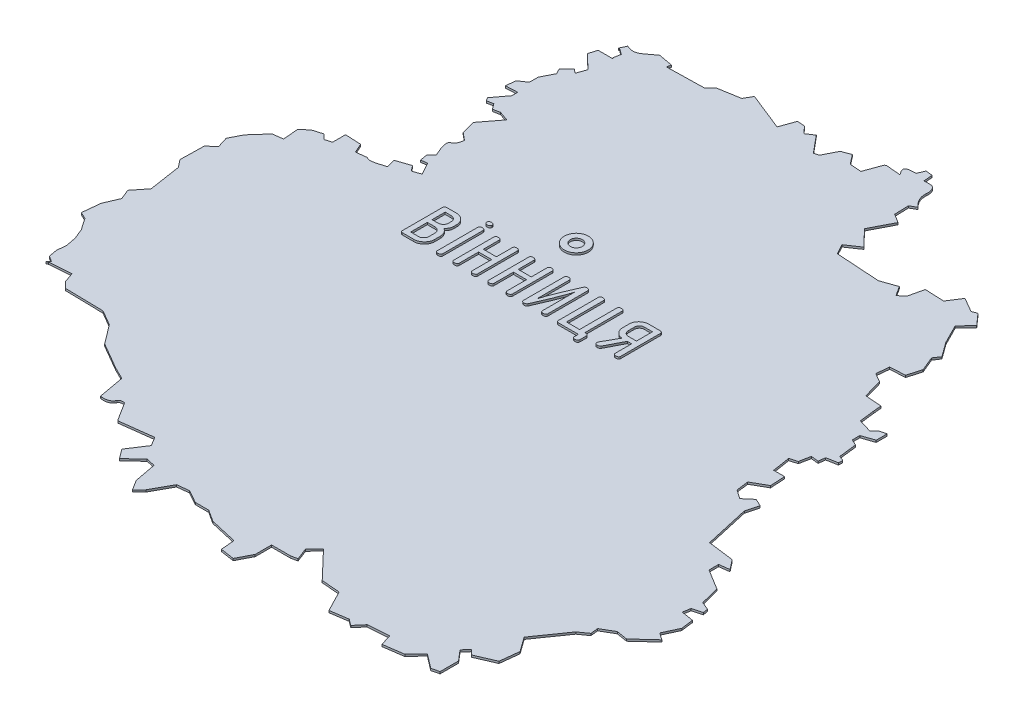
from build123d import *

# Parameters (mm, degrees)
EXTRUDE_1_DEPTH = 5
SKETCH_2_R      = 30
SKETCH_2_R_2    = 15
EXTRUDE_2_DEPTH = 10
SCALE_1_SCALE   = 0.05


with BuildPart() as part:
    # Эскиз1 → Бобышка-Вытянуть1 (new body)
    with BuildSketch(Plane(origin=(0, 0, 0), x_dir=(1, 0, 0), z_dir=(0, 1, 0))):
        with BuildLine():
            Line((-2037.80898, 5856.32306), (-2034.57302, 5821.92384))
            Line((-2034.57302, 5821.92384), (-2000.17888, 5816.7524))
            Line((-2000.17888, 5816.7524), (-1981.3651, 5853.08456))
            Line((-1981.3651, 5853.08456), (-1981.3651, 5893.97602))
            Line((-1981.3651, 5893.97602), (-1933.97886, 5893.97602))
            Line((-1933.97886, 5893.97602), (-1918.40358, 5897.21452))
            Line((-1918.40358, 5897.21452), (-1930.0952, 5927.69198))
            Line((-1930.0952, 5927.69198), (-1908.0353, 5950.4326))
            Line((-1908.0353, 5950.4326), (-1841.19266, 5880.33368))
            Line((-1841.19266, 5880.33368), (-1795.12722, 5876.45764))
            Line((-1795.12722, 5876.45764), (-1767.86794, 5823.88472))
            Line((-1767.86794, 5823.88472), (-1723.72528, 5830.39474))
            Line((-1723.72528, 5830.39474), (-1708.17794, 5818.6955))
            Line((-1708.17794, 5818.6955), (-1689.3413, 5840.77318))
            Line((-1689.3413, 5840.77318), (-1636.78616, 5844.63906))
            Line((-1636.78616, 5844.63906), (-1628.33304, 5816.7524))
            Line((-1628.33304, 5816.7524), (-1578.37886, 5823.88472))
            Line((-1578.37886, 5823.88472), (-1551.1145, 5853.08456))
            Line((-1551.1145, 5853.08456), (-1515.41226, 5825.81766))
            Line((-1515.41226, 5825.81766), (-1496.5934, 5830.39474))
            Line((-1496.5934, 5830.39474), (-1496.5934, 5876.45764))
            Line((-1496.5934, 5876.45764), (-1518.6787, 5902.41136))
            Line((-1518.6787, 5902.41136), (-1505.04144, 5917.9968))
            Line((-1505.04144, 5917.9968), (-1493.35998, 5905.6397))
            Line((-1493.35998, 5905.6397), (-1445.3362, 5926.44992))
            Line((-1445.3362, 5926.44992), (-1440.14444, 5973.78028))
            Line((-1440.14444, 5973.78028), (-1466.09816, 6010.13022))
            Line((-1466.09816, 6010.13022), (-1412.89532, 6086.03812))
            Line((-1412.89532, 6086.03812), (-1390.84558, 6101.62356))
            Line((-1390.84558, 6101.62356), (-1392.77598, 6120.46274))
            Line((-1392.77598, 6120.46274), (-1361.62796, 6138.61104))
            Line((-1361.62796, 6138.61104), (-1334.37884, 6134.06698))
            Line((-1334.37884, 6134.06698), (-1288.29562, 6176.24876))
            Line((-1288.29562, 6176.24876), (-1305.814, 6188.57284))
            Line((-1305.814, 6188.57284), (-1288.29562, 6226.19278))
            Line((-1288.29562, 6226.19278), (-1292.21484, 6256.73628))
            Line((-1292.21484, 6256.73628), (-1322.69484, 6261.90772))
            Line((-1322.69484, 6261.90772), (-1319.45634, 6280.73928))
            Line((-1319.45634, 6280.73928), (-1295.43556, 6287.22644))
            Line((-1295.43556, 6287.22644), (-1297.37358, 6299.5556))
            Line((-1297.37358, 6299.5556), (-1317.49038, 6307.97824))
            Line((-1317.49038, 6307.97824), (-1329.8297, 6355.35432))
            Line((-1329.8297, 6355.35432), (-1380.4392, 6386.50234))
            Line((-1380.4392, 6386.50234), (-1380.4392, 6410.51804))
            Line((-1380.4392, 6410.51804), (-1355.12302, 6413.77178))
            Line((-1355.12302, 6413.77178), (-1373.95712, 6437.77224))
            Line((-1373.95712, 6437.77224), (-1438.85158, 6446.21266))
            Line((-1438.85158, 6446.21266), (-1464.16014, 6558.46796))
            Line((-1464.16014, 6558.46796), (-1455.70956, 6589.6109))
            Line((-1455.70956, 6589.6109), (-1474.54874, 6598.07672))
            Line((-1474.54874, 6598.07672), (-1496.5934, 6579.24516))
            Line((-1496.5934, 6579.24516), (-1518.6787, 6594.81282))
            Line((-1518.6787, 6594.81282), (-1522.55474, 6625.31314))
            Line((-1522.55474, 6625.31314), (-1486.21496, 6646.07764))
            Line((-1486.21496, 6646.07764), (-1488.18854, 6683.06766))
            Line((-1488.18854, 6683.06766), (-1515.41226, 6683.06766))
            Line((-1515.41226, 6683.06766), (-1522.55474, 6727.8377))
            Line((-1522.55474, 6727.8377), (-1503.74096, 6733.02692))
            Line((-1503.74096, 6733.02692), (-1498.5492, 6760.29382))
            Line((-1498.5492, 6760.29382), (-1479.73034, 6758.35072))
            Line((-1479.73034, 6758.35072), (-1477.7974, 6775.21886))
            Line((-1477.7974, 6775.21886), (-1450.53304, 6780.4157))
            Line((-1450.53304, 6780.4157), (-1450.53304, 6790.81192))
            Line((-1450.53304, 6790.81192), (-1462.85966, 6795.98844))
            Line((-1462.85966, 6795.98844), (-1468.0438, 6840.12602))
            Line((-1468.0438, 6840.12602), (-1482.99424, 6847.25834))
            Line((-1482.99424, 6847.25834), (-1482.99424, 6866.08736))
            Line((-1482.99424, 6866.08736), (-1452.47614, 6876.44802))
            Line((-1452.47614, 6876.44802), (-1452.47614, 6903.69714))
            Line((-1452.47614, 6903.69714), (-1468.0438, 6899.8084))
            Line((-1468.0438, 6899.8084), (-1479.73034, 6888.12694))
            Line((-1479.73034, 6888.12694), (-1514.13718, 6898.51808))
            Line((-1514.13718, 6898.51808), (-1518.6787, 6936.16342))
            Line((-1518.6787, 6936.16342), (-1520.6091, 6956.26752))
            Line((-1520.6091, 6956.26752), (-1561.5031, 6959.51364))
            Line((-1561.5031, 6959.51364), (-1575.12512, 7007.55012))
            Line((-1575.12512, 7007.55012), (-1597.2028, 7019.87166))
            Line((-1597.2028, 7019.87166), (-1593.9516, 7051.6623))
            Line((-1593.9516, 7051.6623), (-1556.31134, 7053.61302))
            Line((-1556.31134, 7053.61302), (-1546.57044, 7088.00208))
            Line((-1546.57044, 7088.00208), (-1561.5031, 7123.69924))
            Line((-1561.5031, 7123.69924), (-1551.1145, 7139.2669))
            Line((-1551.1145, 7139.2669), (-1577.06568, 7174.95644))
            Line((-1577.06568, 7174.95644), (-1601.07122, 7222.34014))
            Line((-1601.07122, 7222.34014), (-1575.12512, 7250.24458))
            Line((-1575.12512, 7250.24458), (-1599.7936, 7278.16426))
            Line((-1599.7936, 7278.16426), (-1612.76538, 7273.59734))
            Line((-1612.76538, 7273.59734), (-1648.45492, 7294.36184))
            Line((-1648.45492, 7294.36184), (-1669.20926, 7261.9235))
            Line((-1669.20926, 7261.9235), (-1717.23304, 7263.87422))
            Line((-1717.23304, 7263.87422), (-1725.68108, 7227.52936))
            Line((-1725.68108, 7227.52936), (-1740.60104, 7213.9048))
            Line((-1740.60104, 7213.9048), (-1756.1814, 7237.91288))
            Line((-1756.1814, 7237.91288), (-1795.12722, 7224.27562))
            Line((-1795.12722, 7224.27562), (-1904.78918, 7231.42826))
            Line((-1904.78918, 7231.42826), (-1918.40358, 7256.73174))
            Line((-1918.40358, 7256.73174), (-1885.96016, 7278.79926))
            Line((-1885.96016, 7278.79926), (-1924.91106, 7319.69072))
            Line((-1924.91106, 7319.69072), (-1896.36146, 7374.84428))
            Line((-1896.36146, 7374.84428), (-1918.40358, 7388.4663))
            Line((-1918.40358, 7388.4663), (-1919.7066, 7424.16346))
            Line((-1919.7066, 7424.16346), (-1904.78918, 7432.58864))
            add(Edge.make_bspline(
                [(-1904.78918, 7432.58864), (-1924.91106, 7451.4075), (-1923.60296, 7471.5243)],
                knots=[0.442982456, 0.442982456, 0.442982456, 0.447368421, 0.447368421, 0.447368421], degree=2))
            add(Edge.make_bspline(
                [(-1923.60296, 7471.5243), (-1921.65478, 7492.28626), (-1935.28442, 7497.49326)],
                knots=[0.447368421, 0.447368421, 0.447368421, 0.451754386, 0.451754386, 0.451754386], degree=2))
            Line((-1935.28442, 7497.49326), (-1954.1109, 7497.49326))
            Line((-1954.1109, 7497.49326), (-1956.05908, 7519.55824))
            Line((-1956.05908, 7519.55824), (-1972.93738, 7521.49626))
            Line((-1972.93738, 7521.49626), (-1980.06462, 7503.9855))
            Line((-1980.06462, 7503.9855), (-1996.92768, 7502.6774))
            add(Edge.make_bspline(
                [(-1996.92768, 7502.6774), (-2013.79836, 7500.747), (-1996.92768, 7480.6048)],
                knots=[0.473684211, 0.473684211, 0.473684211, 0.478070175, 0.478070175, 0.478070175], degree=2))
            Line((-1996.92768, 7480.6048), (-2034.57302, 7483.8687))
            Line((-2034.57302, 7483.8687), (-2037.80898, 7481.91544))
            Line((-2037.80898, 7481.91544), (-2053.39442, 7439.08342))
            Line((-2053.39442, 7439.08342), (-2081.95926, 7441.03414))
            Line((-2081.95926, 7441.03414), (-2100.74764, 7465.03206))
            Line((-2100.74764, 7465.03206), (-2122.82532, 7456.6018))
            Line((-2122.82532, 7456.6018), (-2140.36148, 7422.21528))
            Line((-2140.36148, 7422.21528), (-2152.03532, 7418.96916))
            Line((-2152.03532, 7418.96916), (-2187.7274, 7461.79102))
            Line((-2187.7274, 7461.79102), (-2206.55388, 7449.45678))
            Line((-2206.55388, 7449.45678), (-2222.12154, 7466.98786))
            Line((-2222.12154, 7466.98786), (-2240.93024, 7468.28326))
            Line((-2240.93024, 7468.28326), (-2254.57004, 7430.64808))
            Line((-2254.57004, 7430.64808), (-2348.6491, 7468.28326))
            Line((-2348.6491, 7468.28326), (-2360.34072, 7448.17916))
            Line((-2360.34072, 7448.17916), (-2413.54864, 7439.08342))
            Line((-2413.54864, 7439.08342), (-2430.41932, 7424.16346))
            Line((-2430.41932, 7424.16346), (-2522.56798, 7422.21528))
            Line((-2522.56798, 7422.21528), (-2520.62996, 7432.58864))
            Line((-2520.62996, 7432.58864), (-2556.32712, 7439.08342))
            add(Edge.make_bspline(
                [(-2556.32712, 7439.08342), (-2561.51634, 7435.83984), (-2579.0525, 7422.21528)],
                knots=[0.565789474, 0.565789474, 0.565789474, 0.570175439, 0.570175439, 0.570175439], degree=2))
            add(Edge.make_bspline(
                [(-2579.0525, 7422.21528), (-2595.91048, 7408.57802), (-2616.02474, 7418.96916)],
                knots=[0.570175439, 0.570175439, 0.570175439, 0.574561404, 0.574561404, 0.574561404], degree=2))
            Line((-2616.02474, 7418.96916), (-2623.15198, 7403.39896))
            Line((-2623.15198, 7403.39896), (-2622.51952, 7404.69182))
            Line((-2622.51952, 7404.69182), (-2606.27876, 7393.00274))
            Line((-2606.27876, 7393.00274), (-2609.54774, 7374.84428))
            Line((-2609.54774, 7374.84428), (-2606.27876, 7372.89356))
            Line((-2606.27876, 7372.89356), (-2643.9241, 7372.89356))
            Line((-2643.9241, 7372.89356), (-2650.40364, 7352.12144))
            Line((-2650.40364, 7352.12144), (-2614.71918, 7318.36992))
            Line((-2614.71918, 7318.36992), (-2623.15198, 7294.36184))
            Line((-2623.15198, 7294.36184), (-2633.55582, 7302.80988))
            Line((-2633.55582, 7302.80988), (-2652.3696, 7283.98848))
            Line((-2652.3696, 7283.98848), (-2645.22966, 7270.35122))
            Line((-2645.22966, 7270.35122), (-2660.79986, 7239.85598))
            Line((-2660.79986, 7239.85598), (-2660.79986, 7217.8037))
            Line((-2660.79986, 7217.8037), (-2680.91666, 7204.18422))
            Line((-2680.91666, 7204.18422), (-2682.85468, 7180.16598))
            Line((-2682.85468, 7180.16598), (-2653.665, 7181.46646))
            Line((-2653.665, 7181.46646), (-2653.665, 7166.51094))
            Line((-2653.665, 7166.51094), (-2679.61872, 7132.14474))
            Line((-2679.61872, 7132.14474), (-2674.41172, 7123.69924))
            Line((-2674.41172, 7123.69924), (-2658.84914, 7126.9606))
            Line((-2658.84914, 7126.9606), (-2648.4707, 7113.32334))
            Line((-2648.4707, 7113.32334), (-2631.58986, 7116.5593))
            Line((-2631.58986, 7116.5593), (-2607.58432, 7108.11634))
            Line((-2607.58432, 7108.11634), (-2643.9241, 7060.75296))
            Line((-2643.9241, 7060.75296), (-2634.82328, 7026.35882))
            Line((-2634.82328, 7026.35882), (-2616.02474, 7010.78862))
            add(Edge.make_bspline(
                [(-2616.02474, 7010.78862), (-2617.97546, 6991.9596), (-2628.35644, 6988.73126)],
                knots=[0.692982456, 0.692982456, 0.692982456, 0.697368421, 0.697368421, 0.697368421], degree=2))
            add(Edge.make_bspline(
                [(-2628.35644, 6988.73126), (-2638.73488, 6985.48006), (-2619.9211, 6944.5886)],
                knots=[0.697368421, 0.697368421, 0.697368421, 0.701754386, 0.701754386, 0.701754386], degree=2))
            Line((-2619.9211, 6944.5886), (-2631.58986, 6932.26452))
            Line((-2631.58986, 6932.26452), (-2628.35644, 6913.4609))
            Line((-2628.35644, 6913.4609), (-2612.78624, 6915.39892))
            Line((-2612.78624, 6915.39892), (-2595.91048, 6884.88336))
            Line((-2595.91048, 6884.88336), (-2616.02474, 6877.7612))
            Line((-2616.02474, 6877.7612), (-2626.40572, 6891.38068))
            Line((-2626.40572, 6891.38068), (-2660.79986, 6879.70938))
            Line((-2660.79986, 6879.70938), (-2655.61064, 6857.6317))
            add(Edge.make_bspline(
                [(-2655.61064, 6857.6317), (-2693.2509, 6844.01984), (-2699.7406, 6852.4374)],
                knots=[0.736842105, 0.736842105, 0.736842105, 0.74122807, 0.74122807, 0.74122807], degree=2))
            Line((-2699.7406, 6852.4374), (-2726.98972, 6849.19128))
            Line((-2726.98972, 6849.19128), (-2737.36816, 6872.56944))
            Line((-2737.36816, 6872.56944), (-2776.96422, 6874.51508))
            Line((-2776.96422, 6874.51508), (-2776.96422, 6842.06912))
            Line((-2776.96422, 6842.06912), (-2793.82982, 6836.86974))
            Line((-2793.82982, 6836.86974), (-2805.50874, 6849.19128))
            Line((-2805.50874, 6849.19128), (-2829.51428, 6842.06912))
            Line((-2829.51428, 6842.06912), (-2848.35092, 6826.4913))
            Line((-2848.35092, 6826.4913), (-2845.0921, 6787.56072))
            Line((-2845.0921, 6787.56072), (-2870.40574, 6784.30698))
            Line((-2870.40574, 6784.30698), (-2902.84408, 6747.95958))
            Line((-2902.84408, 6747.95958), (-2918.42444, 6717.4745))
            Line((-2918.42444, 6717.4745), (-2909.98402, 6690.2076))
            Line((-2909.98402, 6690.2076), (-2928.80796, 6673.34454))
            Line((-2928.80796, 6673.34454), (-2930.11606, 6613.64438))
            Line((-2930.11606, 6613.64438), (-2915.17324, 6594.81282))
            Line((-2915.17324, 6594.81282), (-2902.84408, 6514.34308))
            Line((-2902.84408, 6514.34308), (-2928.80796, 6481.89712))
            Line((-2928.80796, 6481.89712), (-2918.42444, 6456.59872))
            Line((-2918.42444, 6456.59872), (-2934.0048, 6420.2437))
            Line((-2934.0048, 6420.2437), (-2938.5514, 6375.48128))
            Line((-2938.5514, 6375.48128), (-2921.66294, 6367.70634))
            Line((-2921.66294, 6367.70634), (-2901.54868, 6338.47856))
            Line((-2901.54868, 6338.47856), (-2891.16516, 6313.20302))
            Line((-2891.16516, 6313.20302), (-2885.99118, 6287.22644))
            Line((-2885.99118, 6287.22644), (-2887.93428, 6261.90772))
            Line((-2887.93428, 6261.90772), (-2884.0176, 6241.15592))
            Line((-2884.0176, 6241.15592), (-2870.40574, 6232.72058))
            Line((-2870.40574, 6232.72058), (-2876.88528, 6225.60096))
            Line((-2876.88528, 6225.60096), (-2872.35392, 6227.52628))
            Line((-2872.35392, 6227.52628), (-2817.84044, 6231.4074))
            Line((-2817.84044, 6231.4074), (-2809.4051, 6207.4044))
            Line((-2809.4051, 6207.4044), (-2793.82982, 6191.82404))
            Line((-2793.82982, 6191.82404), (-2698.4325, 6189.87332))
            Line((-2698.4325, 6189.87332), (-2660.79986, 6167.82104))
            Line((-2660.79986, 6167.82104), (-2625.12048, 6120.46274))
            Line((-2625.12048, 6120.46274), (-2560.2184, 6082.80978))
            Line((-2560.2184, 6082.80978), (-2529.07292, 6067.24212))
            add(Edge.make_bspline(
                [(-2529.07292, 6067.24212), (-2517.37368, 6004.941), (-2517.37368, 6002.99028)],
                knots=[0.907894737, 0.907894737, 0.907894737, 0.912280702, 0.912280702, 0.912280702], degree=2))
            add(Edge.make_bspline(
                [(-2517.37368, 6002.99028), (-2517.37368, 6001.6771), (-2494.03108, 5997.78328), (-2487.53122, 6013.3865)],
                knots=[0.912280702, 0.912280702, 0.912280702, 0.912280702, 0.916666667, 0.916666667, 0.916666667, 0.916666667], degree=3))
            add(Edge.make_bspline(
                [(-2487.53122, 6013.3865), (-2484.95058, 6019.85334), (-2473.90158, 6017.91786), (-2473.2488, 6017.91786)],
                knots=[0.916666667, 0.916666667, 0.916666667, 0.916666667, 0.921052632, 0.921052632, 0.921052632, 0.921052632], degree=3))
            add(Edge.make_bspline(
                [(-2473.2488, 6017.91786), (-2471.3057, 6017.91786), (-2444.05404, 5970.524), (-2442.09824, 5970.524)],
                knots=[0.921052632, 0.921052632, 0.921052632, 0.921052632, 0.925438596, 0.925438596, 0.925438596, 0.925438596], degree=3))
            Line((-2442.09824, 5970.524), (-2360.34072, 5980.93038))
            Line((-2360.34072, 5980.93038), (-2346.70854, 5958.87048))
            Line((-2346.70854, 5958.87048), (-2375.91854, 5914.10298))
            Line((-2375.91854, 5914.10298), (-2358.39508, 5890.74768))
            Line((-2358.39508, 5890.74768), (-2322.70046, 5924.46364))
            Line((-2322.70046, 5924.46364), (-2300.64564, 5919.27442))
            Line((-2300.64564, 5919.27442), (-2290.25704, 5864.7584))
            Line((-2290.25704, 5864.7584), (-2274.67922, 5839.44984))
            Line((-2274.67922, 5839.44984), (-2257.806, 5856.32306))
            Line((-2257.806, 5856.32306), (-2230.5518, 5905.6397))
            Line((-2230.5518, 5905.6397), (-2201.35196, 5908.9036))
            Line((-2201.35196, 5908.9036), (-2168.90092, 5890.74768))
            Line((-2168.90092, 5890.74768), (-2135.1621, 5890.74768))
            Line((-2135.1621, 5890.74768), (-2105.96734, 5871.88056))
            Line((-2105.96734, 5871.88056), (-2037.80898, 5856.32306))
        make_face()
    extrude(amount=EXTRUDE_1_DEPTH)

    # Эскиз2 → Бобышка-Вытянуть2 (add)
    # profile 1 of 9: a face of its own
    with BuildSketch(Plane(origin=(0, 0, 0), x_dir=(1, 0, 0), z_dir=(0, 1, 0))):
        with Locations((-2249.074428191, 6923.377157503)):
            Circle(SKETCH_2_R)
        with Locations((-2249.074428191, 6923.377157503)):
            Circle(SKETCH_2_R_2, mode=Mode.SUBTRACT)
    # profile 2 of 9: a face of its own
    with BuildSketch(Plane(origin=(0, 0, 0), x_dir=(1, 0, 0), z_dir=(0, 1, 0))):
        with BuildLine():
            add(Edge.make_bspline(
                [(-2487.905259311, 6728.281603893), (-2488.331896154, 6728.301511254), (-2489.13029253, 6728.338765338), (-2490.255759903, 6728.557457214), (-2491.20455952, 6728.984369631), (-2491.99614166, 6729.56923803), (-2492.599488763, 6730.3503493), (-2493.005960845, 6731.29361721), (-2493.269926059, 6732.394156899), (-2493.300617234, 6733.180639675), (-2493.316999176, 6733.600438353)],
                knots=[0, 0, 0, 0, 1.178388678, 2.205203945, 3.142513155, 4.02719224, 4.89493436, 5.832243571, 6.842922806, 8, 8, 8, 8], degree=3))
            Line((-2493.316999176, 6733.600438353), (-2493.316999176, 6832.962769434))
            add(Edge.make_bspline(
                [(-2493.316999176, 6832.962769434), (-2493.297758316, 6833.382034688), (-2493.261790096, 6834.165795105), (-2493.034010305, 6835.27129262), (-2492.62507538, 6836.222207575), (-2491.996115511, 6836.978224294), (-2491.22720768, 6837.587371481), (-2490.277451164, 6838.003955834), (-2489.161601027, 6838.223384213), (-2488.370732577, 6838.261440686), (-2487.951712014, 6838.281603893)],
                knots=[0, 0, 0, 0, 1.161386961, 2.171057864, 3.111858271, 3.996198585, 4.867172785, 5.807973192, 6.838613039, 8, 8, 8, 8], degree=3))
            Line((-2487.951712014, 6838.281603893), (-2464.609228906, 6838.281603893))
            add(Edge.make_bspline(
                [(-2464.609228906, 6838.281603893), (-2463.686575358, 6838.261270187), (-2461.880882353, 6838.221475802), (-2459.233385768, 6837.850365489), (-2456.700142865, 6837.312494234), (-2454.283713488, 6836.506459821), (-2451.980705006, 6835.494081891), (-2449.802834867, 6834.217032209), (-2447.736456255, 6832.737946665), (-2445.825582411, 6831.039288118), (-2444.065025721, 6829.22488021), (-2442.533370457, 6827.302372485), (-2441.240168893, 6825.300152272), (-2440.165149648, 6823.245368742), (-2439.34993927, 6821.097462049), (-2438.738838032, 6818.900166371), (-2438.382145352, 6816.615306593), (-2438.338929318, 6815.071960049), (-2438.316999176, 6814.288782947)],
                knots=[0, 0, 0, 0, 1.11995412, 2.191823057, 3.241309871, 4.261230133, 5.279935998, 6.291149995, 7.321935457, 8.361305785, 9.392091246, 10.389217116, 11.341206678, 12.283252909, 13.200041413, 14.126185389, 15.049125615, 16, 16, 16, 16], degree=3))
            Line((-2438.316999176, 6814.288782947), (-2438.316999176, 6806.809897812))
            add(Edge.make_bspline(
                [(-2438.316999176, 6806.809897812), (-2438.347188789, 6805.926138755), (-2438.406512908, 6804.189507382), (-2438.771037275, 6801.653760367), (-2439.420853424, 6799.255359417), (-2440.374508477, 6797.017754782), (-2441.518086559, 6794.88022619), (-2442.996137359, 6792.924878763), (-2444.677788538, 6791.068827866), (-2445.989947267, 6790.001159779), (-2446.655259311, 6789.459813353)],
                knots=[0, 0, 0, 0, 1.061275997, 2.085461165, 3.06879059, 4.035634009, 5.000911834, 5.971502377, 6.971478167, 8, 8, 8, 8], degree=3))
            add(Edge.make_bspline(
                [(-2446.655259311, 6789.459813353), (-2445.761726997, 6789.009885566), (-2443.959806703, 6788.102549594), (-2441.554557059, 6786.155303425), (-2439.349646908, 6783.823128879), (-2437.47203774, 6781.073592608), (-2435.876513409, 6778.122555823), (-2434.687818473, 6775.030490948), (-2433.998702514, 6771.838190333), (-2433.904627964, 6769.681875566), (-2433.857539717, 6768.602549839)],
                knots=[0, 0, 0, 0, 0.930523516, 1.876517703, 2.867344312, 3.914784832, 4.97094674, 5.989987574, 6.993904713, 8, 8, 8, 8], degree=3))
            Line((-2433.857539717, 6768.602549839), (-2433.857539717, 6753.064120785))
            add(Edge.make_bspline(
                [(-2433.857539717, 6753.064120785), (-2433.877412216, 6752.295997395), (-2433.916993737, 6750.766069495), (-2434.312367507, 6748.502421153), (-2434.909559236, 6746.279375255), (-2435.780258909, 6744.108021988), (-2436.898074984, 6741.993549373), (-2438.269350837, 6739.93889361), (-2439.840964408, 6737.909484843), (-2441.667099317, 6735.98869335), (-2443.637407657, 6734.191373853), (-2445.731643468, 6732.591850999), (-2447.95320644, 6731.272158486), (-2450.256453984, 6730.1659542), (-2452.667314653, 6729.331750414), (-2455.171060982, 6728.726906391), (-2457.776382828, 6728.340197581), (-2459.552264813, 6728.301303125), (-2460.451712014, 6728.281603893)],
                knots=[0, 0, 0, 0, 0.917949901, 1.828348392, 2.740440823, 3.667315706, 4.620059285, 5.596056403, 6.618609543, 7.686452614, 8.761618673, 9.806200413, 10.83214442, 11.846994998, 12.857399563, 13.877097342, 14.924794062, 16, 16, 16, 16], degree=3))
            Line((-2460.451712014, 6728.281603893), (-2487.905259311, 6728.281603893))
        make_face()
        with BuildLine():
            Line((-2479.938620798, 6793.687009299), (-2464.748587014, 6793.687009299))
            add(Edge.make_bspline(
                [(-2464.748587014, 6793.687009299), (-2463.883570618, 6793.727131903), (-2462.183695983, 6793.805978266), (-2459.744478656, 6794.568493066), (-2457.488144113, 6795.770874261), (-2455.50242851, 6797.446288638), (-2453.814032355, 6799.404794621), (-2452.572595644, 6801.611376381), (-2451.818245846, 6804.005200391), (-2451.736690631, 6805.666432159), (-2451.695377555, 6806.507955245)],
                knots=[0, 0, 0, 0, 1.021027334, 2.006457305, 2.99426919, 4.028852023, 5.062298486, 6.038443649, 7.006342773, 8, 8, 8, 8], degree=3))
            Line((-2451.695377555, 6806.507955245), (-2451.695377555, 6813.63844511))
            add(Edge.make_bspline(
                [(-2451.695377555, 6813.63844511), (-2451.736963481, 6814.479827638), (-2451.819057323, 6816.140781938), (-2452.567396659, 6818.530138375), (-2453.815918754, 6820.718670584), (-2455.502418861, 6822.656144337), (-2457.495531875, 6824.304308676), (-2459.743689123, 6825.509236887), (-2462.183901499, 6826.27048048), (-2463.883639929, 6826.34950085), (-2464.748587014, 6826.389712001)],
                knots=[0, 0, 0, 0, 0.996243721, 1.966662291, 2.937341644, 3.966492765, 4.997936714, 5.988319878, 6.976314928, 8, 8, 8, 8], degree=3))
            Line((-2464.748587014, 6826.389712001), (-2479.938620798, 6826.389712001))
            Line((-2479.938620798, 6826.389712001), (-2479.938620798, 6793.687009299))
        make_face(mode=Mode.SUBTRACT)
        with BuildLine():
            Line((-2479.938620798, 6740.173495785), (-2460.660749176, 6740.173495785))
            add(Edge.make_bspline(
                [(-2460.660749176, 6740.173495785), (-2459.765465484, 6740.223689458), (-2458.014304259, 6740.321867516), (-2455.484379695, 6741.067718772), (-2453.174140983, 6742.326410427), (-2451.127294632, 6744.042508315), (-2449.416405871, 6746.094705336), (-2448.125091458, 6748.391877364), (-2447.385890621, 6750.929509998), (-2447.286653312, 6752.680105863), (-2447.235918095, 6753.575100515)],
                knots=[0, 0, 0, 0, 1.019269311, 1.9936752, 2.976671234, 3.99788619, 5.019101147, 6.0063248, 6.980730689, 8, 8, 8, 8], degree=3))
            Line((-2447.235918095, 6753.575100515), (-2447.235918095, 6768.463191731))
            add(Edge.make_bspline(
                [(-2447.235918095, 6768.463191731), (-2447.286900905, 6769.358086649), (-2447.386622501, 6771.108487435), (-2448.120393642, 6773.640965764), (-2449.416735238, 6775.922507822), (-2451.135641461, 6777.948770014), (-2453.16265492, 6779.665241982), (-2455.483292617, 6780.898430299), (-2458.001589424, 6781.680593473), (-2459.764655495, 6781.7565247), (-2460.660749176, 6781.795117407)],
                knots=[0, 0, 0, 0, 1.021347402, 1.997739913, 2.979242372, 3.995757054, 5.019054068, 5.992078592, 6.979456463, 8, 8, 8, 8], degree=3))
            Line((-2460.660749176, 6781.795117407), (-2479.938620798, 6781.795117407))
            Line((-2479.938620798, 6781.795117407), (-2479.938620798, 6740.173495785))
        make_face(mode=Mode.SUBTRACT)
    # profile 3 of 9: a face of its own
    with BuildSketch(Plane(origin=(0, 0, 0), x_dir=(1, 0, 0), z_dir=(0, 1, 0))):
        with BuildLine():
            add(Edge.make_bspline(
                [(-2392.83051269, 6733.623664704), (-2392.850476989, 6733.202977404), (-2392.88860342, 6732.39957802), (-2393.240634398, 6731.278198033), (-2393.842862078, 6730.332185518), (-2394.694649875, 6729.575801641), (-2395.756776465, 6728.963313753), (-2397.063271037, 6728.554748567), (-2398.591172535, 6728.33930174), (-2399.681584105, 6728.301668392), (-2400.262945122, 6728.281603893)],
                knots=[0, 0, 0, 0, 0.968349646, 1.849286893, 2.676465977, 3.523263178, 4.451261044, 5.484598709, 6.658895142, 8, 8, 8, 8], degree=3))
            add(Edge.make_bspline(
                [(-2400.262945122, 6728.281603893), (-2400.728330619, 6728.301695698), (-2401.603530916, 6728.339480188), (-2402.833713529, 6728.557061008), (-2403.886974461, 6728.973415168), (-2404.735916183, 6729.59192541), (-2405.414900603, 6730.35550212), (-2405.887413875, 6731.298346082), (-2406.163016593, 6732.408147716), (-2406.193049543, 6733.203918357), (-2406.208891068, 6733.623664704)],
                knots=[0, 0, 0, 0, 1.220860227, 2.29594012, 3.261114875, 4.162696787, 5.025975332, 5.915822489, 6.900655729, 8, 8, 8, 8], degree=3))
            Line((-2406.208891068, 6733.623664704), (-2406.208891068, 6833.636333623))
            add(Edge.make_bspline(
                [(-2406.208891068, 6833.636333623), (-2406.192873751, 6834.055911666), (-2406.162507528, 6834.85136323), (-2405.889134027, 6835.963299129), (-2405.406496851, 6836.904288372), (-2404.751743508, 6837.69354013), (-2403.877461417, 6838.281438819), (-2402.835358529, 6838.705044842), (-2401.60303308, 6838.919880327), (-2400.728157795, 6838.958081212), (-2400.262945122, 6838.978394434)],
                knots=[0, 0, 0, 0, 1.098843442, 2.08322802, 2.972669788, 3.850929026, 4.740370794, 5.705105844, 6.779695961, 8, 8, 8, 8], degree=3))
            add(Edge.make_bspline(
                [(-2400.262945122, 6838.978394434), (-2399.6817682, 6838.9580387), (-2398.591701922, 6838.919859106), (-2397.0615465, 6838.707977947), (-2395.765814702, 6838.289335697), (-2394.679375901, 6837.712917654), (-2393.85094318, 6836.926151823), (-2393.239169879, 6835.983529376), (-2392.889022783, 6834.859925188), (-2392.850621113, 6834.056850763), (-2392.83051269, 6833.636333623)],
                knots=[0, 0, 0, 0, 1.340544031, 2.514349394, 3.547254935, 4.466065479, 5.324653274, 6.151486447, 7.032055301, 8, 8, 8, 8], degree=3))
            Line((-2392.83051269, 6833.636333623), (-2392.83051269, 6733.623664704))
        make_face()
    # profile 4 of 9: a face of its own
    with BuildSketch(Plane(origin=(0, 0, 0), x_dir=(1, 0, 0), z_dir=(0, 1, 0))):
        with BuildLine():
            add(Edge.make_bspline(
                [(-2400.262945122, 6862.065387677), (-2399.681709619, 6862.045088345), (-2398.591533466, 6862.007014538), (-2397.062095265, 6861.794442842), (-2395.764105786, 6861.377974275), (-2394.689510267, 6860.79716493), (-2393.834922832, 6860.034347526), (-2393.252576088, 6859.078532779), (-2392.883847817, 6857.964897689), (-2392.848953831, 6857.167807723), (-2392.83051269, 6856.746553218)],
                knots=[0, 0, 0, 0, 1.342902474, 2.518772933, 3.553495682, 4.473922706, 5.321854953, 6.165250748, 7.030352379, 8, 8, 8, 8], degree=3))
            add(Edge.make_bspline(
                [(-2392.83051269, 6856.746553218), (-2392.849473371, 6856.317925482), (-2392.885372138, 6855.506393098), (-2393.245670645, 6854.37263578), (-2393.842633472, 6853.412573573), (-2394.68045032, 6852.624515902), (-2395.765244488, 6852.045336894), (-2397.06396658, 6851.635169484), (-2398.588974875, 6851.384338682), (-2399.681249359, 6851.352023142), (-2400.262945122, 6851.334813353)],
                knots=[0, 0, 0, 0, 0.981339183, 1.857995784, 2.696169867, 3.550943068, 4.465671455, 5.493987931, 6.665411832, 8, 8, 8, 8], degree=3))
            add(Edge.make_bspline(
                [(-2400.262945122, 6851.334813353), (-2400.728782429, 6851.352074135), (-2401.606365635, 6851.384591438), (-2402.832420587, 6851.637947259), (-2403.878022366, 6852.053227179), (-2404.750890006, 6852.643697113), (-2405.413856335, 6853.435980259), (-2405.883213073, 6854.391736077), (-2406.165651315, 6855.51523331), (-2406.193875365, 6856.318957467), (-2406.208891068, 6856.746553218)],
                knots=[0, 0, 0, 0, 1.213876563, 2.286801999, 3.246455683, 4.131212664, 5.004846013, 5.90761226, 6.886811976, 8, 8, 8, 8], degree=3))
            add(Edge.make_bspline(
                [(-2406.208891068, 6856.746553218), (-2406.194386308, 6857.166694062), (-2406.167147022, 6857.955699644), (-2405.877132926, 6859.060224246), (-2405.421527586, 6860.009375539), (-2404.742071374, 6860.780135365), (-2403.878867556, 6861.369528393), (-2402.834923054, 6861.791698556), (-2401.603164871, 6862.006976324), (-2400.728203546, 6862.045110126), (-2400.262945122, 6862.065387677)],
                knots=[0, 0, 0, 0, 1.101172267, 2.067951921, 2.977421716, 3.842135725, 4.733462525, 5.700242178, 6.77710972, 8, 8, 8, 8], degree=3))
        make_face()
    # profile 5 of 9: a face of its own
    with BuildSketch(Plane(origin=(0, 0, 0), x_dir=(1, 0, 0), z_dir=(0, 1, 0))):
        with BuildLine():
            Line((-2319.10078296, 6793.687009299), (-2319.10078296, 6833.078901191))
            add(Edge.make_bspline(
                [(-2319.10078296, 6833.078901191), (-2319.086373979, 6833.49140465), (-2319.059339347, 6834.265358039), (-2318.768680114, 6835.346462426), (-2318.313951465, 6836.27556058), (-2317.625013667, 6837.017527114), (-2316.777210782, 6837.617032163), (-2315.717494005, 6837.992305889), (-2314.500208394, 6838.263060467), (-2313.621212238, 6838.275175784), (-2313.154837014, 6838.281603893)],
                knots=[0, 0, 0, 0, 1.091529518, 2.047965782, 2.948064081, 3.805939007, 4.706037306, 5.674741692, 6.76627121, 8, 8, 8, 8], degree=3))
            add(Edge.make_bspline(
                [(-2313.154837014, 6838.281603893), (-2312.573601511, 6838.261304561), (-2311.483425358, 6838.223230755), (-2309.953987157, 6838.010659058), (-2308.655997678, 6837.594190491), (-2307.581402158, 6837.013381147), (-2306.726814724, 6836.250563742), (-2306.14446798, 6835.294748995), (-2305.775739709, 6834.181113905), (-2305.740845723, 6833.384023939), (-2305.722404582, 6832.962769434)],
                knots=[0, 0, 0, 0, 1.342902474, 2.518772933, 3.553495682, 4.473922706, 5.321854953, 6.165250748, 7.030352379, 8, 8, 8, 8], degree=3))
            Line((-2305.722404582, 6832.962769434), (-2305.722404582, 6733.600438353))
            add(Edge.make_bspline(
                [(-2305.722404582, 6733.600438353), (-2305.740845723, 6733.179183847), (-2305.775739709, 6732.382093882), (-2306.14446798, 6731.268458792), (-2306.726814724, 6730.312644045), (-2307.581402158, 6729.54982664), (-2308.655997678, 6728.969017295), (-2309.953987157, 6728.552548728), (-2311.483425358, 6728.339977032), (-2312.573601511, 6728.301903226), (-2313.154837014, 6728.281603893)],
                knots=[0, 0, 0, 0, 0.969647621, 1.834749252, 2.678145047, 3.526077294, 4.446504318, 5.481227067, 6.657097526, 8, 8, 8, 8], degree=3))
            add(Edge.make_bspline(
                [(-2313.154837014, 6728.281603893), (-2313.620095438, 6728.301881444), (-2314.495056763, 6728.340015247), (-2315.726814946, 6728.555293014), (-2316.770759448, 6728.977463177), (-2317.633963266, 6729.566856205), (-2318.313419478, 6730.337616032), (-2318.769024818, 6731.286767324), (-2319.059038914, 6732.391291927), (-2319.0862782, 6733.180297509), (-2319.10078296, 6733.600438353)],
                knots=[0, 0, 0, 0, 1.22289028, 2.299757822, 3.266537475, 4.157864275, 5.022578284, 5.932048079, 6.898827733, 8, 8, 8, 8], degree=3))
            Line((-2319.10078296, 6733.600438353), (-2319.10078296, 6781.795117407))
            Line((-2319.10078296, 6781.795117407), (-2351.803485663, 6781.795117407))
            Line((-2351.803485663, 6781.795117407), (-2351.803485663, 6733.600438353))
            add(Edge.make_bspline(
                [(-2351.803485663, 6733.600438353), (-2351.821926804, 6733.179183847), (-2351.85682079, 6732.382093882), (-2352.225549061, 6731.268458792), (-2352.807895805, 6730.312644045), (-2353.66248324, 6729.54982664), (-2354.737078759, 6728.969017295), (-2356.035068238, 6728.552548728), (-2357.564506439, 6728.339977032), (-2358.654682592, 6728.301903226), (-2359.235918095, 6728.281603893)],
                knots=[0, 0, 0, 0, 0.969647621, 1.834749252, 2.678145047, 3.526077294, 4.446504318, 5.481227067, 6.657097526, 8, 8, 8, 8], degree=3))
            add(Edge.make_bspline(
                [(-2359.235918095, 6728.281603893), (-2359.701176519, 6728.301881444), (-2360.576137844, 6728.340015247), (-2361.807896027, 6728.555293014), (-2362.851840529, 6728.977463177), (-2363.715044347, 6729.566856205), (-2364.394500559, 6730.337616032), (-2364.850105899, 6731.286767324), (-2365.140119995, 6732.391291927), (-2365.167359281, 6733.180297509), (-2365.181864041, 6733.600438353)],
                knots=[0, 0, 0, 0, 1.22289028, 2.299757822, 3.266537475, 4.157864275, 5.022578284, 5.932048079, 6.898827733, 8, 8, 8, 8], degree=3))
            Line((-2365.181864041, 6733.600438353), (-2365.181864041, 6832.962769434))
            add(Edge.make_bspline(
                [(-2365.181864041, 6832.962769434), (-2365.167359281, 6833.382910278), (-2365.140119995, 6834.17191586), (-2364.850105899, 6835.276440463), (-2364.394500559, 6836.225591755), (-2363.715044347, 6836.996351581), (-2362.851840529, 6837.58574461), (-2361.807896027, 6838.007914772), (-2360.576137844, 6838.22319254), (-2359.701176519, 6838.261326342), (-2359.235918095, 6838.281603893)],
                knots=[0, 0, 0, 0, 1.101172267, 2.067951921, 2.977421716, 3.842135725, 4.733462525, 5.700242178, 6.77710972, 8, 8, 8, 8], degree=3))
            add(Edge.make_bspline(
                [(-2359.235918095, 6838.281603893), (-2358.653733985, 6838.275365993), (-2357.560225156, 6838.263649427), (-2356.042945257, 6837.993926481), (-2354.731449021, 6837.626280836), (-2353.671155418, 6837.032851332), (-2352.808389537, 6836.300415815), (-2352.226114143, 6835.36513973), (-2351.85654507, 6834.2747292), (-2351.821838791, 6833.49253538), (-2351.803485663, 6833.078901191)],
                knots=[0, 0, 0, 0, 1.353106154, 2.541521659, 3.579288285, 4.507284885, 5.350131461, 6.185231121, 7.040326791, 8, 8, 8, 8], degree=3))
            Line((-2351.803485663, 6833.078901191), (-2351.803485663, 6793.687009299))
            Line((-2351.803485663, 6793.687009299), (-2319.10078296, 6793.687009299))
        make_face()
    # profile 6 of 9: a face of its own
    with BuildSketch(Plane(origin=(0, 0, 0), x_dir=(1, 0, 0), z_dir=(0, 1, 0))):
        with BuildLine():
            Line((-2231.992674852, 6793.687009299), (-2231.992674852, 6833.078901191))
            add(Edge.make_bspline(
                [(-2231.992674852, 6833.078901191), (-2231.978265871, 6833.49140465), (-2231.951231239, 6834.265358039), (-2231.660572006, 6835.346462426), (-2231.205843357, 6836.27556058), (-2230.516905559, 6837.017527114), (-2229.669102674, 6837.617032163), (-2228.609385897, 6837.992305889), (-2227.392100286, 6838.263060467), (-2226.51310413, 6838.275175784), (-2226.046728906, 6838.281603893)],
                knots=[0, 0, 0, 0, 1.091529518, 2.047965782, 2.948064081, 3.805939007, 4.706037306, 5.674741692, 6.76627121, 8, 8, 8, 8], degree=3))
            add(Edge.make_bspline(
                [(-2226.046728906, 6838.281603893), (-2225.465493403, 6838.261304561), (-2224.37531725, 6838.223230755), (-2222.845879049, 6838.010659058), (-2221.54788957, 6837.594190491), (-2220.47329405, 6837.013381147), (-2219.618706615, 6836.250563742), (-2219.036359872, 6835.294748995), (-2218.667631601, 6834.181113905), (-2218.632737615, 6833.384023939), (-2218.614296473, 6832.962769434)],
                knots=[0, 0, 0, 0, 1.342902474, 2.518772933, 3.553495682, 4.473922706, 5.321854953, 6.165250748, 7.030352379, 8, 8, 8, 8], degree=3))
            Line((-2218.614296473, 6832.962769434), (-2218.614296473, 6733.600438353))
            add(Edge.make_bspline(
                [(-2218.614296473, 6733.600438353), (-2218.632737615, 6733.179183847), (-2218.667631601, 6732.382093882), (-2219.036359872, 6731.268458792), (-2219.618706615, 6730.312644045), (-2220.47329405, 6729.54982664), (-2221.54788957, 6728.969017295), (-2222.845879049, 6728.552548728), (-2224.37531725, 6728.339977032), (-2225.465493403, 6728.301903226), (-2226.046728906, 6728.281603893)],
                knots=[0, 0, 0, 0, 0.969647621, 1.834749252, 2.678145047, 3.526077294, 4.446504318, 5.481227067, 6.657097526, 8, 8, 8, 8], degree=3))
            add(Edge.make_bspline(
                [(-2226.046728906, 6728.281603893), (-2226.51198733, 6728.301881444), (-2227.386948655, 6728.340015247), (-2228.618706838, 6728.555293014), (-2229.662651339, 6728.977463177), (-2230.525855158, 6729.566856205), (-2231.205311369, 6730.337616032), (-2231.66091671, 6731.286767324), (-2231.950930805, 6732.391291927), (-2231.978170092, 6733.180297509), (-2231.992674852, 6733.600438353)],
                knots=[0, 0, 0, 0, 1.22289028, 2.299757822, 3.266537475, 4.157864275, 5.022578284, 5.932048079, 6.898827733, 8, 8, 8, 8], degree=3))
            Line((-2231.992674852, 6733.600438353), (-2231.992674852, 6781.795117407))
            Line((-2231.992674852, 6781.795117407), (-2264.695377555, 6781.795117407))
            Line((-2264.695377555, 6781.795117407), (-2264.695377555, 6733.600438353))
            add(Edge.make_bspline(
                [(-2264.695377555, 6733.600438353), (-2264.713818696, 6733.179183847), (-2264.748712682, 6732.382093882), (-2265.117440953, 6731.268458792), (-2265.699787696, 6730.312644045), (-2266.554375131, 6729.54982664), (-2267.628970651, 6728.969017295), (-2268.92696013, 6728.552548728), (-2270.456398331, 6728.339977032), (-2271.546574484, 6728.301903226), (-2272.127809987, 6728.281603893)],
                knots=[0, 0, 0, 0, 0.969647621, 1.834749252, 2.678145047, 3.526077294, 4.446504318, 5.481227067, 6.657097526, 8, 8, 8, 8], degree=3))
            add(Edge.make_bspline(
                [(-2272.127809987, 6728.281603893), (-2272.593068411, 6728.301881444), (-2273.468029736, 6728.340015247), (-2274.699787919, 6728.555293014), (-2275.743732421, 6728.977463177), (-2276.606936239, 6729.566856205), (-2277.286392451, 6730.337616032), (-2277.741997791, 6731.286767324), (-2278.032011887, 6732.391291927), (-2278.059251173, 6733.180297509), (-2278.073755933, 6733.600438353)],
                knots=[0, 0, 0, 0, 1.22289028, 2.299757822, 3.266537475, 4.157864275, 5.022578284, 5.932048079, 6.898827733, 8, 8, 8, 8], degree=3))
            Line((-2278.073755933, 6733.600438353), (-2278.073755933, 6832.962769434))
            add(Edge.make_bspline(
                [(-2278.073755933, 6832.962769434), (-2278.059251173, 6833.382910278), (-2278.032011887, 6834.17191586), (-2277.741997791, 6835.276440463), (-2277.286392451, 6836.225591755), (-2276.606936239, 6836.996351581), (-2275.743732421, 6837.58574461), (-2274.699787919, 6838.007914772), (-2273.468029736, 6838.22319254), (-2272.593068411, 6838.261326342), (-2272.127809987, 6838.281603893)],
                knots=[0, 0, 0, 0, 1.101172267, 2.067951921, 2.977421716, 3.842135725, 4.733462525, 5.700242178, 6.77710972, 8, 8, 8, 8], degree=3))
            add(Edge.make_bspline(
                [(-2272.127809987, 6838.281603893), (-2271.545625876, 6838.275365993), (-2270.452117047, 6838.263649427), (-2268.934837149, 6837.993926481), (-2267.623340913, 6837.626280836), (-2266.563047309, 6837.032851332), (-2265.700281429, 6836.300415815), (-2265.118006035, 6835.36513973), (-2264.748436961, 6834.2747292), (-2264.713730683, 6833.49253538), (-2264.695377555, 6833.078901191)],
                knots=[0, 0, 0, 0, 1.353106154, 2.541521659, 3.579288285, 4.507284885, 5.350131461, 6.185231121, 7.040326791, 8, 8, 8, 8], degree=3))
            Line((-2264.695377555, 6833.078901191), (-2264.695377555, 6793.687009299))
            Line((-2264.695377555, 6793.687009299), (-2231.992674852, 6793.687009299))
        make_face()
    # profile 7 of 9: a face of its own
    with BuildSketch(Plane(origin=(0, 0, 0), x_dir=(1, 0, 0), z_dir=(0, 1, 0))):
        with BuildLine():
            add(Edge.make_bspline(
                [(-2131.506188365, 6735.063698488), (-2131.526867499, 6734.650881211), (-2131.56671092, 6733.855487489), (-2131.916062827, 6732.741039604), (-2132.519392235, 6731.796943076), (-2133.364049123, 6731.035656141), (-2134.440138625, 6730.455710192), (-2135.737656249, 6730.038968933), (-2137.267244349, 6729.826483865), (-2138.357397538, 6729.788396788), (-2138.938620798, 6729.76809038)],
                knots=[0, 0, 0, 0, 0.953740082, 1.837614163, 2.667550865, 3.517171085, 4.439430397, 5.476212962, 6.654424219, 8, 8, 8, 8], degree=3))
            add(Edge.make_bspline(
                [(-2138.938620798, 6729.76809038), (-2139.403871972, 6729.788371489), (-2140.278819663, 6729.826511984), (-2141.510667736, 6730.041745629), (-2142.554320411, 6730.464059037), (-2143.418500222, 6731.05297299), (-2144.089817523, 6731.820211533), (-2144.55869138, 6732.754708479), (-2144.839653244, 6733.847610538), (-2144.869049511, 6734.62834859), (-2144.884566744, 6735.040472137)],
                knots=[0, 0, 0, 0, 1.228791976, 2.310856505, 3.282301858, 4.177930221, 5.04681736, 5.942445723, 6.913891076, 8, 8, 8, 8], degree=3))
            Line((-2144.884566744, 6735.040472137), (-2144.884566744, 6815.008799839))
            add(Edge.make_bspline(
                [(-2144.884566744, 6815.008799839), (-2145.149604826, 6814.047023682), (-2145.711974843, 6812.006282706), (-2146.725399268, 6808.824980429), (-2147.857699619, 6805.318196308), (-2149.194897801, 6801.515777996), (-2150.669661874, 6797.392526002), (-2152.332734871, 6792.968945732), (-2154.138605736, 6788.236175245), (-2156.11639156, 6783.197263359), (-2158.253649259, 6777.844343496), (-2160.578424004, 6772.188725346), (-2163.062357501, 6766.218932845), (-2165.717121651, 6759.942948612), (-2168.521612951, 6753.351839909), (-2171.498060861, 6746.455057535), (-2174.627717328, 6739.248814431), (-2176.801683693, 6734.357568745), (-2177.912438365, 6731.858462001)],
                knots=[0, 0, 0, 0, 0.534819233, 1.134804096, 1.789814632, 2.510503038, 3.295666462, 4.137599038, 5.044164315, 6.011541378, 7.039786653, 8.134359685, 9.289900099, 10.506440011, 11.787824629, 13.130253246, 14.53374704, 16, 16, 16, 16], degree=3))
            add(Edge.make_bspline(
                [(-2177.912438365, 6731.858462001), (-2178.275637108, 6731.310553272), (-2178.997861236, 6730.221031589), (-2180.690505461, 6729.074843333), (-2182.754779318, 6728.394908611), (-2184.262762764, 6728.320986543), (-2185.066154582, 6728.281603893)],
                knots=[0, 0, 0, 0, 0.931236219, 1.851772014, 2.855512113, 4, 4, 4, 4], degree=3))
            add(Edge.make_bspline(
                [(-2185.066154582, 6728.281603893), (-2185.532434955, 6728.296181261), (-2186.404975361, 6728.323459575), (-2187.625959351, 6728.608602619), (-2188.659552527, 6729.064535965), (-2189.520235221, 6729.719271653), (-2190.171310986, 6730.57307131), (-2190.648512578, 6731.609876944), (-2190.91814211, 6732.828199223), (-2190.94928036, 6733.699750064), (-2190.965647825, 6734.157870785)],
                knots=[0, 0, 0, 0, 1.171630376, 2.192446653, 3.134147218, 3.995415972, 4.884019595, 5.808017826, 6.847809664, 8, 8, 8, 8], degree=3))
            Line((-2190.965647825, 6734.157870785), (-2190.965647825, 6834.426029569))
            add(Edge.make_bspline(
                [(-2190.965647825, 6834.426029569), (-2190.949630507, 6834.845607611), (-2190.919264285, 6835.641059176), (-2190.645890784, 6836.752995075), (-2190.163253607, 6837.693984318), (-2189.508500265, 6838.483236076), (-2188.634218174, 6839.071134765), (-2187.592115286, 6839.494740788), (-2186.359789837, 6839.709576273), (-2185.484914552, 6839.747777158), (-2185.019701879, 6839.76809038)],
                knots=[0, 0, 0, 0, 1.098843442, 2.08322802, 2.972669788, 3.850929026, 4.740370794, 5.705105844, 6.779695961, 8, 8, 8, 8], degree=3))
            add(Edge.make_bspline(
                [(-2185.019701879, 6839.76809038), (-2184.438524957, 6839.747734646), (-2183.348458679, 6839.709555052), (-2181.818303257, 6839.497673893), (-2180.522571458, 6839.079031643), (-2179.436132658, 6838.5026136), (-2178.607699937, 6837.715847769), (-2177.995926636, 6836.773225322), (-2177.64577954, 6835.649621134), (-2177.60737787, 6834.846546709), (-2177.587269446, 6834.426029569)],
                knots=[0, 0, 0, 0, 1.340544031, 2.514349394, 3.547254935, 4.466065479, 5.324653274, 6.151486447, 7.032055301, 8, 8, 8, 8], degree=3))
            Line((-2177.587269446, 6834.426029569), (-2177.587269446, 6753.040894434))
            add(Edge.make_bspline(
                [(-2177.587269446, 6753.040894434), (-2177.330468654, 6754.002766595), (-2176.787474297, 6756.036604386), (-2175.790783298, 6759.218752299), (-2174.65915632, 6762.720525329), (-2173.354188522, 6766.528715676), (-2171.888724819, 6770.639261191), (-2170.261140057, 6775.06257788), (-2168.448965889, 6779.790193705), (-2166.466008918, 6784.823885899), (-2164.365903825, 6790.188563452), (-2162.024625824, 6795.831193246), (-2159.58013135, 6801.814083808), (-2156.915432469, 6808.071728011), (-2154.135144493, 6814.662023103), (-2151.164785653, 6821.553865772), (-2147.997625357, 6828.743639029), (-2145.844210546, 6833.643910741), (-2144.745208636, 6836.144779569)],
                knots=[0, 0, 0, 0, 0.534342487, 1.129844471, 1.789587048, 2.509780447, 3.29056652, 4.132056478, 5.039701852, 6.008231463, 7.036165613, 8.132042737, 9.287368917, 10.505358234, 11.78281919, 13.126847198, 14.533677579, 16, 16, 16, 16], degree=3))
            add(Edge.make_bspline(
                [(-2144.745208636, 6836.144779569), (-2144.400576848, 6836.692984857), (-2143.741567855, 6837.741269513), (-2142.342886828, 6838.927179988), (-2140.688727484, 6839.643645059), (-2139.503228101, 6839.725763052), (-2138.892168095, 6839.76809038)],
                knots=[0, 0, 0, 0, 1.068047448, 2.042333001, 2.990929877, 4, 4, 4, 4], degree=3))
            add(Edge.make_bspline(
                [(-2138.892168095, 6839.76809038), (-2138.309811032, 6839.754350941), (-2137.222566925, 6839.728699799), (-2135.709265599, 6839.437481553), (-2134.401819309, 6839.020551381), (-2133.335809707, 6838.363189993), (-2132.508837882, 6837.514937847), (-2131.915687762, 6836.488047141), (-2131.562649385, 6835.26908189), (-2131.525672456, 6834.397522931), (-2131.506188365, 6833.938276191)],
                knots=[0, 0, 0, 0, 1.29965344, 2.426416082, 3.433331493, 4.350449838, 5.194812866, 6.055508021, 6.975397369, 8, 8, 8, 8], degree=3))
            Line((-2131.506188365, 6833.938276191), (-2131.506188365, 6735.063698488))
        make_face()
    # profile 8 of 9: a face of its own
    with BuildSketch(Plane(origin=(0, 0, 0), x_dir=(1, 0, 0), z_dir=(0, 1, 0))):
        with BuildLine():
            add(Edge.make_bspline(
                [(-2035.479161338, 6718.874931596), (-2035.499183128, 6718.446581579), (-2035.537436627, 6717.628178865), (-2035.888946477, 6716.484065824), (-2036.490851228, 6715.516313544), (-2037.335257152, 6714.73308153), (-2038.406257272, 6714.121367217), (-2039.713893013, 6713.719356611), (-2041.237232014, 6713.465571457), (-2042.329761961, 6713.433708038), (-2042.911593771, 6713.416739028)],
                knots=[0, 0, 0, 0, 0.978196174, 1.868935147, 2.704424746, 3.5564603, 4.476991117, 5.502014125, 6.669686219, 8, 8, 8, 8], degree=3))
            add(Edge.make_bspline(
                [(-2042.911593771, 6713.416739028), (-2043.376709495, 6713.437219301), (-2044.251402458, 6713.47573434), (-2045.484929972, 6713.688498577), (-2046.519083236, 6714.117151335), (-2047.398284953, 6714.675892757), (-2048.062045557, 6715.44714951), (-2048.527189823, 6716.37326669), (-2048.815572282, 6717.456761115), (-2048.842948615, 6718.230355804), (-2048.857539717, 6718.642668083)],
                knots=[0, 0, 0, 0, 1.233611578, 2.319920209, 3.295175793, 4.182775495, 5.055070607, 5.954211828, 6.90963111, 8, 8, 8, 8], degree=3))
            Line((-2048.857539717, 6718.642668083), (-2048.857539717, 6728.281603893))
            Line((-2048.857539717, 6728.281603893), (-2098.445799852, 6728.281603893))
            add(Edge.make_bspline(
                [(-2098.445799852, 6728.281603893), (-2098.872429884, 6728.301514114), (-2099.670813513, 6728.33877355), (-2100.796364698, 6728.557430234), (-2101.744886628, 6728.984459251), (-2102.53742576, 6729.568925812), (-2103.132879448, 6730.345873148), (-2103.556429871, 6731.282169578), (-2103.804669372, 6732.380124539), (-2103.839359801, 6733.165583349), (-2103.857539717, 6733.577212001)],
                knots=[0, 0, 0, 0, 1.181336006, 2.210719494, 3.150373057, 4.037264857, 4.907177332, 5.827337472, 6.861391407, 8, 8, 8, 8], degree=3))
            Line((-2103.857539717, 6733.577212001), (-2103.857539717, 6832.985995785))
            add(Edge.make_bspline(
                [(-2103.857539717, 6832.985995785), (-2103.841106921, 6833.397898141), (-2103.80967682, 6834.185720999), (-2103.53639497, 6835.2885461), (-2103.062458856, 6836.229403901), (-2102.391563664, 6836.99674279), (-2101.52726662, 6837.585628874), (-2100.483648998, 6838.007950615), (-2099.251790127, 6838.223181693), (-2098.376844074, 6838.261322577), (-2097.911593771, 6838.281603893)],
                knots=[0, 0, 0, 0, 1.083429305, 2.072215321, 2.965634013, 3.832377457, 4.725796149, 5.694844779, 6.774239667, 8, 8, 8, 8], degree=3))
            add(Edge.make_bspline(
                [(-2097.911593771, 6838.281603893), (-2097.33050611, 6838.261047055), (-2096.240607254, 6838.222490265), (-2094.709358975, 6838.013071285), (-2093.420595917, 6837.587842822), (-2092.331012294, 6837.040861751), (-2091.492753545, 6836.27456379), (-2090.894525423, 6835.338079334), (-2090.536248, 6834.234102913), (-2090.498786382, 6833.445548859), (-2090.479161338, 6833.032448488)],
                knots=[0, 0, 0, 0, 1.349898262, 2.531894363, 3.572007453, 4.488635547, 5.340985057, 6.173587819, 7.043196157, 8, 8, 8, 8], degree=3))
            Line((-2090.479161338, 6833.032448488), (-2090.479161338, 6740.173495785))
            Line((-2090.479161338, 6740.173495785), (-2057.776458636, 6740.173495785))
            Line((-2057.776458636, 6740.173495785), (-2057.776458636, 6833.032448488))
            add(Edge.make_bspline(
                [(-2057.776458636, 6833.032448488), (-2057.760908511, 6833.444524066), (-2057.731449933, 6834.225171247), (-2057.450906914, 6835.318684135), (-2056.980611025, 6836.251107237), (-2056.31729887, 6837.022473326), (-2055.437973795, 6837.581184673), (-2054.403857719, 6838.009846498), (-2053.170318706, 6838.222607931), (-2052.295627486, 6838.261123395), (-2051.83051269, 6838.281603893)],
                knots=[0, 0, 0, 0, 1.087671966, 2.060515348, 2.957432629, 3.827570202, 4.712974511, 5.685817892, 6.769439643, 8, 8, 8, 8], degree=3))
            add(Edge.make_bspline(
                [(-2051.83051269, 6838.281603893), (-2051.249425029, 6838.261047055), (-2050.159526173, 6838.222490265), (-2048.628277894, 6838.013071285), (-2047.339514836, 6837.587842822), (-2046.249931213, 6837.040861751), (-2045.411672464, 6836.27456379), (-2044.813444342, 6835.338079334), (-2044.455166918, 6834.234102913), (-2044.417705301, 6833.445548859), (-2044.398080257, 6833.032448488)],
                knots=[0, 0, 0, 0, 1.349898262, 2.531894363, 3.572007453, 4.488635547, 5.340985057, 6.173587819, 7.043196157, 8, 8, 8, 8], degree=3))
            Line((-2044.398080257, 6833.032448488), (-2044.398080257, 6740.173495785))
            Line((-2044.398080257, 6740.173495785), (-2042.958046473, 6740.173495785))
            add(Edge.make_bspline(
                [(-2042.958046473, 6740.173495785), (-2042.376402063, 6740.155736511), (-2041.276586709, 6740.122155989), (-2039.743487259, 6739.875472317), (-2038.425616973, 6739.462129858), (-2037.338599826, 6738.864724635), (-2036.491261941, 6738.073180097), (-2035.888830152, 6737.106378909), (-2035.537469914, 6735.961995879), (-2035.499194565, 6735.143632597), (-2035.479161338, 6734.715303218)],
                knots=[0, 0, 0, 0, 1.324874151, 2.505167947, 3.525999654, 4.458082004, 5.306633599, 6.138706896, 7.025803653, 8, 8, 8, 8], degree=3))
            Line((-2035.479161338, 6734.715303218), (-2035.479161338, 6718.874931596))
        make_face()
    # profile 9 of 9: a face of its own
    with BuildSketch(Plane(origin=(0, 0, 0), x_dir=(1, 0, 0), z_dir=(0, 1, 0))):
        with BuildLine():
            add(Edge.make_bspline(
                [(-1948.37105323, 6733.600438353), (-1948.389494372, 6733.179183847), (-1948.424388357, 6732.382093882), (-1948.793116629, 6731.268458792), (-1949.375463372, 6730.312644045), (-1950.230050807, 6729.54982664), (-1951.304646326, 6728.969017295), (-1952.602635806, 6728.552548728), (-1954.132074006, 6728.339977032), (-1955.22225016, 6728.301903226), (-1955.803485663, 6728.281603893)],
                knots=[0, 0, 0, 0, 0.969647621, 1.834749252, 2.678145047, 3.526077294, 4.446504318, 5.481227067, 6.657097526, 8, 8, 8, 8], degree=3))
            add(Edge.make_bspline(
                [(-1955.803485663, 6728.281603893), (-1956.268744087, 6728.301881444), (-1957.143705411, 6728.340015247), (-1958.375463595, 6728.555293014), (-1959.419408096, 6728.977463177), (-1960.282611915, 6729.566856205), (-1960.962068126, 6730.337616032), (-1961.417673467, 6731.286767324), (-1961.707687562, 6732.391291927), (-1961.734926848, 6733.180297509), (-1961.749431609, 6733.600438353)],
                knots=[0, 0, 0, 0, 1.22289028, 2.299757822, 3.266537475, 4.157864275, 5.022578284, 5.932048079, 6.898827733, 8, 8, 8, 8], degree=3))
            Line((-1961.749431609, 6733.600438353), (-1961.749431609, 6774.362684974))
            Line((-1961.749431609, 6774.362684974), (-1972.642590392, 6774.362684974))
            Line((-1972.642590392, 6774.362684974), (-1994.893434987, 6731.068766056))
            add(Edge.make_bspline(
                [(-1994.893434987, 6731.068766056), (-1995.235062614, 6730.642422672), (-1995.931116038, 6729.773764085), (-1997.456549013, 6728.875845288), (-1999.314578094, 6728.383570751), (-2000.658055258, 6728.317038672), (-2001.373587014, 6728.281603893)],
                knots=[0, 0, 0, 0, 0.886684332, 1.806585934, 2.831794496, 4, 4, 4, 4], degree=3))
            add(Edge.make_bspline(
                [(-2001.373587014, 6728.281603893), (-2001.877351426, 6728.302564617), (-2002.828778551, 6728.342151774), (-2004.161585534, 6728.548850813), (-2005.288050137, 6728.97739916), (-2006.218300946, 6729.56483964), (-2006.971433903, 6730.325327377), (-2007.477500388, 6731.279266729), (-2007.794050221, 6732.388243472), (-2007.817864397, 6733.179945807), (-2007.83051269, 6733.600438353)],
                knots=[0, 0, 0, 0, 1.265134057, 2.38937652, 3.367108917, 4.267056613, 5.132587691, 6.019439933, 6.948075927, 8, 8, 8, 8], degree=3))
            add(Edge.make_bspline(
                [(-2007.83051269, 6733.600438353), (-2007.83051269, 6733.95657574), (-2007.83051269, 6734.723045335), (-2007.83051269, 6735.489514929), (-2007.83051269, 6735.899847137)],
                knots=[0, 0, 0, 0, 0.929292929, 2, 2, 2, 2], degree=3))
            Line((-2007.83051269, 6735.899847137), (-1986.137100528, 6774.45559038))
            add(Edge.make_bspline(
                [(-1986.137100528, 6774.45559038), (-1986.827973441, 6774.50243675), (-1988.204203141, 6774.595755455), (-1990.235097095, 6775.005023654), (-1992.214352725, 6775.604361431), (-1994.133363873, 6776.430472308), (-1995.995860537, 6777.452014991), (-1997.793589947, 6778.698508072), (-1999.537710093, 6780.147657066), (-2001.220120907, 6781.775166493), (-2002.75438298, 6783.567069014), (-2004.116910407, 6785.457077934), (-2005.263278068, 6787.440694746), (-2006.188319499, 6789.523645847), (-2006.946943117, 6791.677981586), (-2007.440815848, 6793.933343265), (-2007.792796085, 6796.261782154), (-2007.817814345, 6797.850880727), (-2007.83051269, 6798.657448488)],
                knots=[0, 0, 0, 0, 0.928403893, 1.849395144, 2.772902849, 3.699211544, 4.647801115, 5.618994046, 6.629994966, 7.688002768, 8.756316003, 9.791374155, 10.810722028, 11.824495155, 12.846328537, 13.869587034, 14.91868104, 16, 16, 16, 16], degree=3))
            Line((-2007.83051269, 6798.657448488), (-2007.83051269, 6813.917161326))
            add(Edge.make_bspline(
                [(-2007.83051269, 6813.917161326), (-2007.809122178, 6814.739199252), (-2007.766750623, 6816.36753928), (-2007.402298797, 6818.753537499), (-2006.854820867, 6821.064258799), (-2006.032868396, 6823.261492713), (-2005.001763319, 6825.379718101), (-2003.740081536, 6827.396348352), (-2002.271164515, 6829.346504035), (-2000.561933063, 6831.155082233), (-1998.69406458, 6832.814922226), (-1996.719586207, 6834.288636067), (-1994.64213868, 6835.528025674), (-1992.46000032, 6836.532787983), (-1990.189299381, 6837.322186002), (-1987.816694611, 6837.885742508), (-1985.348740195, 6838.210607636), (-1983.668309193, 6838.257707494), (-1982.815732284, 6838.281603893)],
                knots=[0, 0, 0, 0, 1.015382339, 2.011327765, 2.976744927, 3.945475617, 4.904040363, 5.883813083, 6.880861032, 7.916597674, 8.953571123, 9.965928326, 10.957081981, 11.937461907, 12.930000178, 13.923322208, 14.946384867, 16, 16, 16, 16], degree=3))
            Line((-1982.815732284, 6838.281603893), (-1955.269279582, 6838.281603893))
            add(Edge.make_bspline(
                [(-1955.269279582, 6838.281603893), (-1954.726715427, 6838.261578749), (-1953.713449296, 6838.224180775), (-1952.290777838, 6838.009540262), (-1951.087016005, 6837.589199456), (-1950.084074984, 6837.013289902), (-1949.302023711, 6836.238799059), (-1948.77086147, 6835.286726914), (-1948.429538239, 6834.177593485), (-1948.391313826, 6833.383613335), (-1948.37105323, 6832.962769434)],
                knots=[0, 0, 0, 0, 1.311732788, 2.449727646, 3.461545579, 4.37596936, 5.222620336, 6.085851813, 6.985418475, 8, 8, 8, 8], degree=3))
            Line((-1948.37105323, 6832.962769434), (-1948.37105323, 6733.600438353))
        make_face()
        with BuildLine():
            Line((-1961.749431609, 6786.254576866), (-1961.749431609, 6826.389712001))
            Line((-1961.749431609, 6826.389712001), (-1982.583468771, 6826.389712001))
            add(Edge.make_bspline(
                [(-1982.583468771, 6826.389712001), (-1983.324206229, 6826.343835912), (-1984.805559369, 6826.252091276), (-1986.955416021, 6825.539441789), (-1988.991790698, 6824.400673514), (-1990.840687052, 6822.825057958), (-1992.456618228, 6820.928018139), (-1993.610412725, 6818.679143635), (-1994.334714565, 6816.168021757), (-1994.412062795, 6814.394607129), (-1994.452134311, 6813.47586065)],
                knots=[0, 0, 0, 0, 0.912140734, 1.824131516, 2.764571924, 3.774437129, 4.805080412, 5.817290368, 6.869211545, 8, 8, 8, 8], degree=3))
            Line((-1994.452134311, 6813.47586065), (-1994.452134311, 6799.098749164))
            add(Edge.make_bspline(
                [(-1994.452134311, 6799.098749164), (-1994.409810322, 6798.180544339), (-1994.328210068, 6796.410254059), (-1993.633787071, 6793.887047339), (-1992.490141975, 6791.632334535), (-1990.870871819, 6789.745241901), (-1988.999215695, 6788.225935116), (-1986.984791272, 6787.072786027), (-1984.816424844, 6786.397088539), (-1983.331167917, 6786.302296505), (-1982.583468771, 6786.254576866)],
                knots=[0, 0, 0, 0, 1.131769793, 2.182041533, 3.203614182, 4.227820963, 5.226380128, 6.167636684, 7.077562634, 8, 8, 8, 8], degree=3))
            Line((-1982.583468771, 6786.254576866), (-1961.749431609, 6786.254576866))
        make_face(mode=Mode.SUBTRACT)
    extrude(amount=EXTRUDE_2_DEPTH)


with BuildPart() as part_1:
    # Масштаб1: scaled about (-2114.896250904, 2.564670722, -6614.20998989)
    add(part.part.scale(SCALE_1_SCALE).moved(Location((-2009.151438359, 2.436437186, -6283.499490395))))


solid = part_1.part
